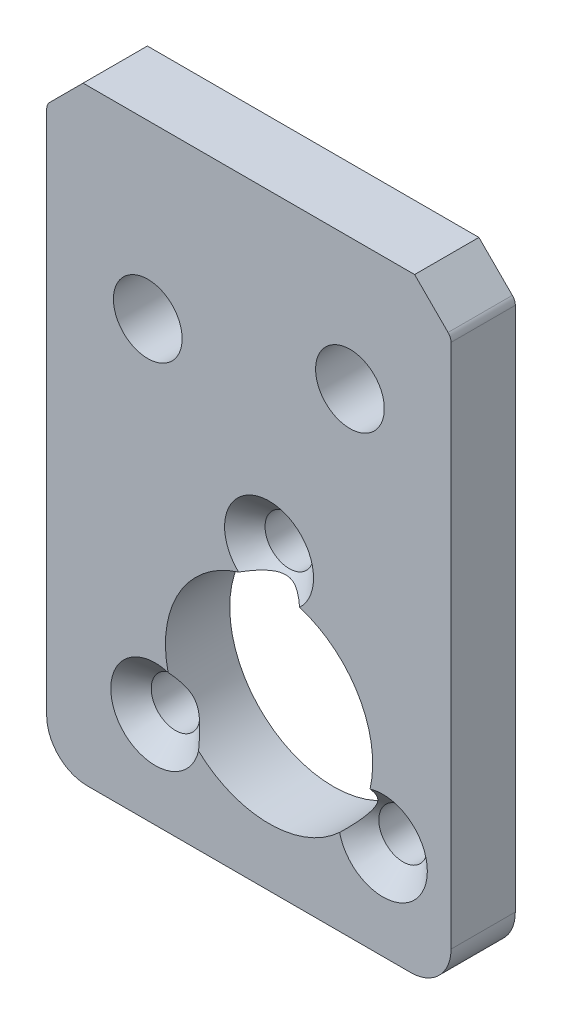
from build123d import *

# Parameters (mm, degrees)
SKETCH12_W                                      = 20
SKETCH12_H                                      = 30
SKETCH12_R                                      = 5.125
SKETCH12_R_2                                    = 1.7
BOSS_EXTRUDE3_DEPTH                             = 3.18
CSK_FOR_M2_FLAT_HEAD_MACHINE_SCREW2_D           = 2.4
CSK_FOR_M2_FLAT_HEAD_MACHINE_SCREW2_CSINK_D     = 4.4
CSK_FOR_M2_FLAT_HEAD_MACHINE_SCREW2_CSINK_ANGLE = 90
CHAMFER1_SIZE                                   = 1.8
FILLET3_R                                       = 0.5
FILLET4_R                                       = 2


with BuildPart() as part:
    # Sketch12 → Boss-Extrude3 (new body)
    with BuildSketch(Plane.XY):
        with Locations((-10, -15)):
            Rectangle(SKETCH12_W, SKETCH12_H)
        with Locations((-9, -22)):
            Circle(SKETCH12_R, mode=Mode.SUBTRACT)
        with Locations((-5, -6.5)):
            Circle(SKETCH12_R_2, mode=Mode.SUBTRACT)
        with Locations((-15, -8.5)):
            Circle(SKETCH12_R_2, mode=Mode.SUBTRACT)
    extrude(amount=BOSS_EXTRUDE3_DEPTH)

    # CSK for M2 Flat Head Machine Screw2 (through all)
    with Locations(Plane.XY.offset(3.18)):
        with Locations((-9, -15.5), (-14.629165125, -25.25), (-3.370834875, -25.25)):
            CounterSinkHole(CSK_FOR_M2_FLAT_HEAD_MACHINE_SCREW2_D / 2, CSK_FOR_M2_FLAT_HEAD_MACHINE_SCREW2_CSINK_D / 2, counter_sink_angle=CSK_FOR_M2_FLAT_HEAD_MACHINE_SCREW2_CSINK_ANGLE)

    # Chamfer1
    chamfer1_edges = [part.edges().sort_by_distance(p)[0] for p in [
        (-20, 0, 1.59),
        (0, 0, 1.59),
    ]]
    chamfer(chamfer1_edges, length=CHAMFER1_SIZE)

    # Fillet3
    fillet3_edges = [part.edges().sort_by_distance(p)[0] for p in [
        (-20, -1.8, 1.59),
        (0, -1.8, 1.59),
    ]]
    fillet(fillet3_edges, radius=FILLET3_R)

    # Fillet4
    fillet4_edges = [part.edges().sort_by_distance(p)[0] for p in [
        (-20, -30, 1.59),
        (0, -30, 1.59),
    ]]
    fillet(fillet4_edges, radius=FILLET4_R)


solid = part.part
